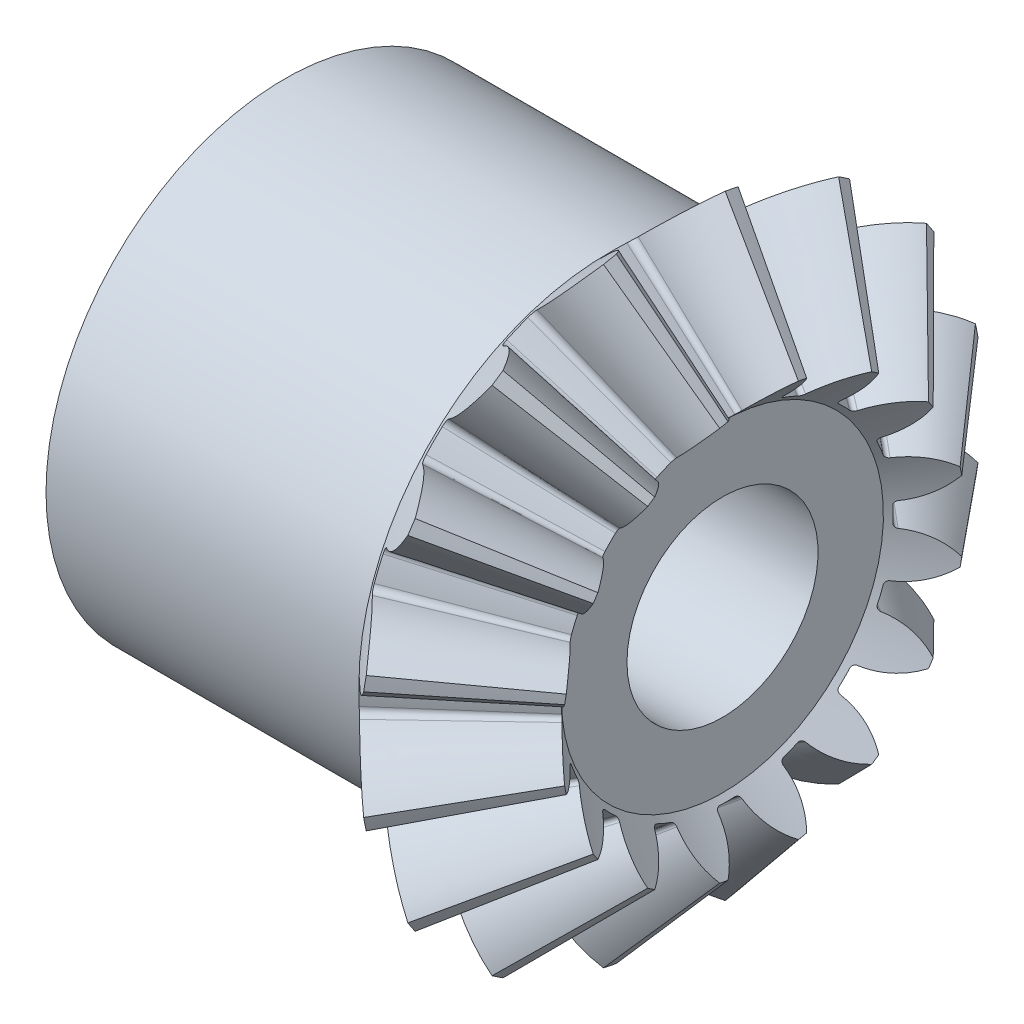
from build123d import *

# Parameters (mm, degrees)
TEETHCUTS_COUNT = 16
TEETHCUTS_ANGLE = 337.5
HUBSKE_R        = 10
HUB_DEPTH       = 13.524137361
BORSKE_R        = 4
BORE_DEPTH      = 27.1000508


with BuildPart() as part:
    # BasProSke → Base-Revolve (revolve)
    with BuildSketch(Plane(origin=(0, 0, 0), x_dir=(1, 0, 0), z_dir=(0, 1, 0)), mode=Mode.PRIVATE) as base_revolve_sk:
        Polygon((0, 0), (0, 10.424035763), (2.636624413, 13.060660171), (6.504265095, 8.44301948), (4.799828184, 6.738582572), (4.799828184, 0), align=None)
    revolve(base_revolve_sk.sketch.rotate(Axis((-10, 0, 0), (1, 0, 0)), 180), axis=Axis((-10, 0, 0), (1, 0, 0)))

    # ToothCut: read off the stored shape, not the designer's step
    # ToothCut: loft between two sections, ruled curve by curve
    toothcut_from = [
        Edge.make_bspline([(13.581753774, 0.005789534, -0.009708365), (13.577619641, 0.001655401, -0.014639112), (13.572239857, -0.003724383, -0.013857939), (13.568900482, -0.007063758, -0.007841999)], [0, 0, 0, 0, 1, 1, 1, 1], 3, [1, 0.796394536, 0.796394536, 1]),
        Edge.make_bspline([(13.568900482, -0.007063758, 0.007841999), (13.572239857, -0.003724383, 0.013857939), (13.577619641, 0.001655401, 0.014639112), (13.581753774, 0.005789534, 0.009708365)], [0, 0, 0, 0, 1, 1, 1, 1], 3, [1, 0.796394536, 0.796394536, 1]),
        Edge.make_bspline([(13.568900482, -0.007063758, -0.007841999), (13.568355373, -0.007608867, -0.006859976), (13.567917794, -0.008046446, -0.005775675), (13.567597175, -0.008367065, -0.004612462)], [0, 0, 0, 0, 1, 1, 1, 1], 3, [1, 0.992817275, 0.992817275, 1]),
        Edge.make_bspline([(13.567597175, -0.008367065, 0.004612462), (13.567917794, -0.008046446, 0.005775675), (13.568355373, -0.007608867, 0.006859976), (13.568900482, -0.007063758, 0.007841999)], [0, 0, 0, 0, 1, 1, 1, 1], 3, [1, 0.992817275, 0.992817275, 1]),
        Edge.make_bspline([(13.567597175, -0.008367065, -0.004612462), (13.566769824, -0.009194416, -0.001610815), (13.566769824, -0.009194416, 0.001610815), (13.567597175, -0.008367065, 0.004612462)], [0, 0, 0, 0, 1, 1, 1, 1], 3, [1, 0.954477777, 0.954477777, 1]),
        Edge.make_line((13.581753774, 0.005789534, 0.009708365), (13.581753774, 0.005789534, -0.009708365)),
    ]
    toothcut_to = [
        Edge.make_bspline([(2.666330942, 13.0903667, -2.495361275), (2.112679945, 12.536715704, -1.537412229), (1.348381452, 11.772417212, -0.935398228), (0.481002944, 10.905038706, -0.774046812)], [0, 0, 0, 0, 1, 1, 1, 1], 3, [1, 0.953086618, 0.953086618, 1]),
        Edge.make_bspline([(0.481002944, 10.905038706, 0.774046812), (1.348381452, 11.772417212, 0.935398228), (2.112679945, 12.536715704, 1.537412229), (2.666330942, 13.0903667, 2.495361275)], [0, 0, 0, 0, 1, 1, 1, 1], 3, [1, 0.953086618, 0.953086618, 1]),
        Edge.make_bspline([(0.481002944, 10.905038706, -0.774046812), (0.372359356, 10.796395118, -0.753836722), (0.302060284, 10.726096046, -0.63496121), (0.307210139, 10.731245901, -0.480163715)], [0, 0, 0, 0, 1, 1, 1, 1], 3, [1, 0.824064014, 0.824064014, 1]),
        Edge.make_bspline([(0.307210139, 10.731245901, 0.480163715), (0.302060284, 10.726096046, 0.63496121), (0.372359356, 10.796395118, 0.753836722), (0.481002944, 10.905038706, 0.774046812)], [0, 0, 0, 0, 1, 1, 1, 1], 3, [1, 0.824064014, 0.824064014, 1]),
        Edge.make_bspline([(0.307210139, 10.731245901, -0.480163715), (0.317855713, 10.741891475, -0.16017256), (0.317855713, 10.741891475, 0.16017256), (0.307210139, 10.731245901, 0.480163715)], [0, 0, 0, 0, 1, 1, 1, 1], 3, [1, 0.999263368, 0.999263368, 1]),
        Edge.make_line((2.666330942, 13.0903667, 2.495361275), (2.666330942, 13.0903667, -2.495361275)),
    ]
    toothcut = Solid(Shell([*[Face.make_surface_from_curves(toothcut_from[k], toothcut_to[k]) for k in range(6)], Face(Wire(toothcut_from)), Face(Wire(toothcut_to))]))
    add(toothcut, mode=Mode.SUBTRACT)

    # TeethCuts: ToothCut ×16 about axis
    teethcuts_axis = Axis((-10, 0, 0), (1, 0, 0))
    for i in range(1, TEETHCUTS_COUNT):
        add(toothcut.rotate(teethcuts_axis, i * TEETHCUTS_ANGLE / (TEETHCUTS_COUNT - 1)), mode=Mode.SUBTRACT)

    # HubSke → Hub (add)
    with BuildSketch(Plane.ZY):
        with Locations(Location((0, 0, 0), (0, 0, 180))):
            Circle(HUBSKE_R)
    extrude(amount=HUB_DEPTH)

    # BorSke → Bore (cut, symmetric)
    with BuildSketch(Plane(origin=(0, 0, 0), x_dir=(0, 0, -1), z_dir=(1, 0, 0))):
        with Locations(Location((0, 0, 0), (0, 0, 180))):
            Circle(BORSKE_R)
    extrude(amount=BORE_DEPTH, both=True, mode=Mode.SUBTRACT)


solid = part.part
